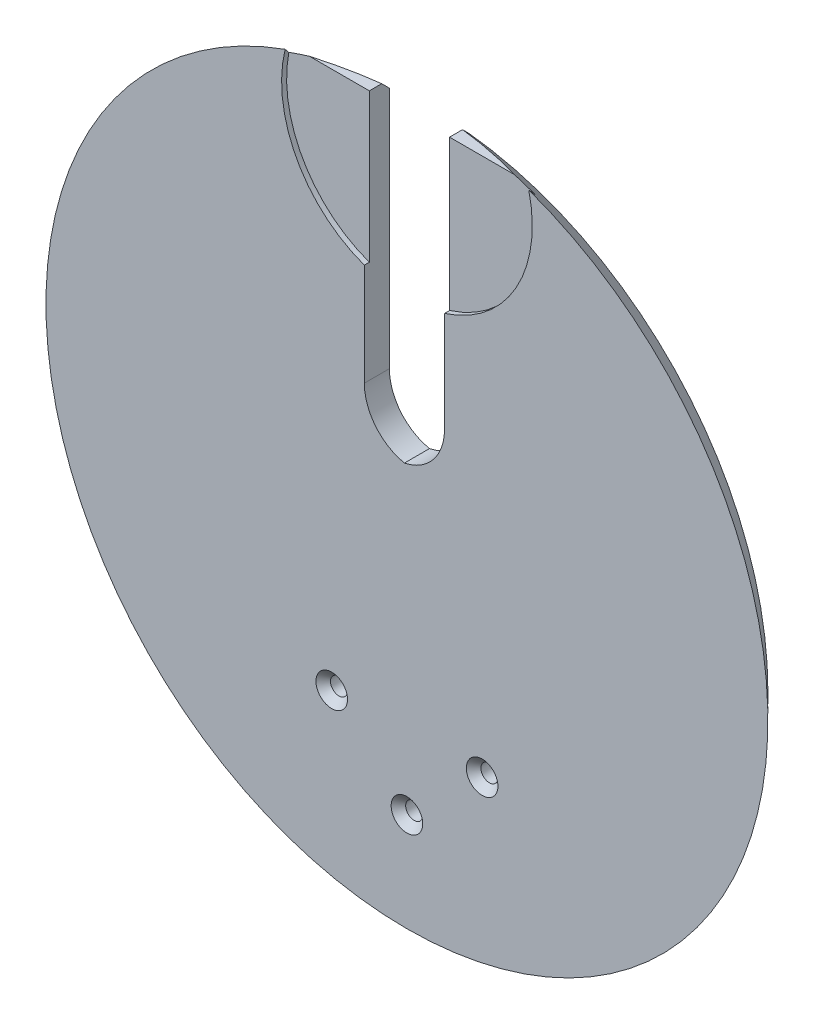
from build123d import *

# Parameters (mm, degrees)
BOSS_EXTRUDE2_DEPTH                                 = 5
CSK_FOR_M3_COUNTERSUNK_FLAT_HEAD_SCREW1_D           = 3.4
CSK_FOR_M3_COUNTERSUNK_FLAT_HEAD_SCREW1_DEPTH       = 5
CSK_FOR_M3_COUNTERSUNK_FLAT_HEAD_SCREW1_CSINK_D     = 6.3
CSK_FOR_M3_COUNTERSUNK_FLAT_HEAD_SCREW1_CSINK_ANGLE = 90
CSK_FOR_M3_COUNTERSUNK_FLAT_HEAD_SCREW1_TIP         = 1.021463052
CUT_EXTRUDE1_REACH                                  = 103.946
SKETCH4_W                                           = 16
SKETCH4_H                                           = 60
SKETCH5_R                                           = 25
CUT_EXTRUDE2_DEPTH                                  = 1
FILLET1_R                                           = 10


with BuildPart() as part:
    # Sketch1 → Boss-Extrude2 (new body)
    with BuildSketch(Plane.XY):
        with BuildLine():
            Line((-23.664319132, 68), (23.664319132, 68))
            ThreePointArc((23.664319132, 68), (0, -72), (-23.664319132, 68))
        make_face()
    extrude(amount=BOSS_EXTRUDE2_DEPTH)

    # Chamfer1: read off the stored shape, not the designer's step
    # Chamfer1 outline → Chamfer1 (revolve, cut)
    with BuildSketch(Plane.XZ):
        Polygon((72.000000172, 5.000000172), (67, 0), (72.000000172, 0), align=None)
    revolve(axis=Axis((0, 0, 0), (0, 0, 1)), mode=Mode.SUBTRACT)

    # CSK for M3 Countersunk Flat Head Screw1
    with Locations(Plane.XY.offset(5)):
        with Locations((15, -38.31), (-15, -38.31), (0, -52.31)):
            CounterSinkHole(CSK_FOR_M3_COUNTERSUNK_FLAT_HEAD_SCREW1_D / 2, CSK_FOR_M3_COUNTERSUNK_FLAT_HEAD_SCREW1_CSINK_D / 2, depth=CSK_FOR_M3_COUNTERSUNK_FLAT_HEAD_SCREW1_DEPTH, counter_sink_angle=CSK_FOR_M3_COUNTERSUNK_FLAT_HEAD_SCREW1_CSINK_ANGLE)
            with Locations((0, 0, -(CSK_FOR_M3_COUNTERSUNK_FLAT_HEAD_SCREW1_DEPTH + CSK_FOR_M3_COUNTERSUNK_FLAT_HEAD_SCREW1_TIP / 2))):  # 118° drill point
                Cone(0, CSK_FOR_M3_COUNTERSUNK_FLAT_HEAD_SCREW1_D / 2, CSK_FOR_M3_COUNTERSUNK_FLAT_HEAD_SCREW1_TIP, mode=Mode.SUBTRACT)

    # Cut-Extrude1: up to this face of the body (flat: up to its plane)
    cut_extrude1_end = Plane(part.part.faces().sort_by_distance((0, 0.083165236, 0))[0])
    # Sketch4 → Cut-Extrude1 (cut, up to the picked face)
    with BuildSketch(Plane.XY.offset(5), mode=Mode.PRIVATE) as cut_extrude1_sk1:
        with Locations((-0.5, 38)):
            Rectangle(SKETCH4_W, SKETCH4_H)
    cut_extrude1_tool1 = split(extrude(cut_extrude1_sk1.sketch, amount=-CUT_EXTRUDE1_REACH, mode=Mode.PRIVATE), bisect_by=cut_extrude1_end, keep=Keep.BOTH, mode=Mode.PRIVATE)
    add(cut_extrude1_tool1.solids().sort_by(Axis((-0.5, 38, 5), (0, 0, -1)))[0], mode=Mode.SUBTRACT)

    # Sketch5 → Cut-Extrude2 (cut)
    with BuildSketch(Plane.XY.offset(5)):
        with Locations((0, 61.9)):
            Circle(SKETCH5_R)
    extrude(amount=-CUT_EXTRUDE2_DEPTH, mode=Mode.SUBTRACT)

    # Fillet1
    # the kernel refuses this fillet: 10 mm, written as the material it adds along each edge
    with BuildSketch(Plane(origin=(-8.5, 8, 5), x_dir=(1, 0, 0), z_dir=(0, 0, -1)), Plane(origin=(7.5, 8, 5), x_dir=(0, 1, 0), z_dir=(0, 0, -1))) as fillet1_piece_1:
        with BuildLine():
            CenterArc((FILLET1_R, -FILLET1_R), FILLET1_R, 90, 90)
            Line((0, -FILLET1_R), (0, 0))
            Line((0, 0), (FILLET1_R, 0))
        make_face()
    extrude(amount=5)


solid = part.part
